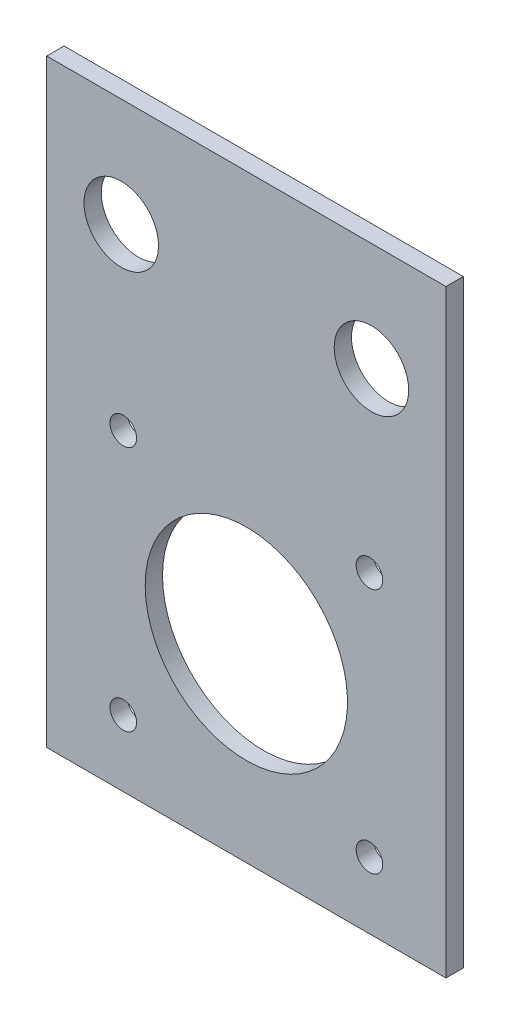
from build123d import *

# Parameters (mm, degrees)
SKETCH1_W           = 76.2
SKETCH1_H           = 114.3
SKETCH1_R           = 2.54
SKETCH1_R_2         = 7.112
SKETCH1_R_3         = 19.304
BOSS_EXTRUDE1_DEPTH = 3.302


with BuildPart() as part:
    # Sketch1 → Boss-Extrude1 (new body)
    with BuildSketch(Plane.XY):
        with Locations((38.1, 57.15)):
            Rectangle(SKETCH1_W, SKETCH1_H)
        with Locations((61.595, 12.7)):
            Circle(SKETCH1_R, mode=Mode.SUBTRACT)
        with Locations((61.595, 59.69)):
            Circle(SKETCH1_R, mode=Mode.SUBTRACT)
        with Locations((14.605, 12.7)):
            Circle(SKETCH1_R, mode=Mode.SUBTRACT)
        with Locations((14.605, 59.69)):
            Circle(SKETCH1_R, mode=Mode.SUBTRACT)
        with Locations((14.224, 93.599)):
            Circle(SKETCH1_R_2, mode=Mode.SUBTRACT)
        with Locations((61.976, 93.599)):
            Circle(SKETCH1_R_2, mode=Mode.SUBTRACT)
        with Locations((38.1, 36.195)):
            Circle(SKETCH1_R_3, mode=Mode.SUBTRACT)
    extrude(amount=BOSS_EXTRUDE1_DEPTH)


solid = part.part
